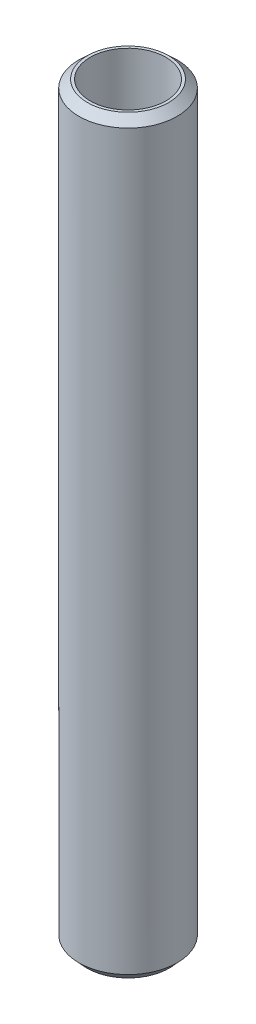
from build123d import *
from OCP.BRepFilletAPI import BRepFilletAPI_MakeChamfer

# Parameters (mm, degrees)
SKETCH1_R           = 22.5
BOSS_EXTRUDE1_DEPTH = 343.666464801
SKETCH2_R           = 17.361282438
CUT_EXTRUDE1_DEPTH  = 346.136406409
CHAMFER1_SIZE       = 3.567688405
CHAMFER1_SIZE2      = 3.870433617


with BuildPart() as part:
    # Sketch1 → Boss-Extrude1 (new body)
    with BuildSketch(Plane(origin=(0, 0, 0), x_dir=(1, 0, 0), z_dir=(0, 1, 0))):
        Circle(SKETCH1_R)
    extrude(amount=BOSS_EXTRUDE1_DEPTH)

    # Sketch2 → Cut-Extrude1 (cut, through all)
    with BuildSketch(Plane(origin=(0, 0, 0), x_dir=(1, 0, 0), z_dir=(0, 1, 0))):
        Circle(SKETCH2_R)
    extrude(amount=CUT_EXTRUDE1_DEPTH, mode=Mode.SUBTRACT)

    # Chamfer1: one chamfer whose edges measure the first distance from different faces: ONE call of the kernel's chamfer builder (chamfer() names one face for all edges)
    chamfer1_edges_1 = [part.edges().sort_by_distance(p)[0] for p in [
        (-22.5, 343.666464801, 0),
    ]]
    chamfer1_side_1 = [part.faces().sort_by_distance(p)[0] for p in [
        (-22.5, 171.833232401, 0),
    ]]
    chamfer1_edges_2 = [part.edges().sort_by_distance(p)[0] for p in [
        (-22.5, 0, 0),
    ]]
    chamfer1_side_2 = [part.faces().sort_by_distance(p)[0] for p in [
        (-21.863603897, 0, 0),
    ]]
    chamfer1 = BRepFilletAPI_MakeChamfer(part.part.solid().wrapped)
    for e in chamfer1_edges_1:
        chamfer1.Add(CHAMFER1_SIZE, CHAMFER1_SIZE2, e.wrapped, chamfer1_side_1[0].wrapped)  # the first distance lies on this face
    for e in chamfer1_edges_2:
        chamfer1.Add(CHAMFER1_SIZE, CHAMFER1_SIZE2, e.wrapped, chamfer1_side_2[0].wrapped)  # the first distance lies on this face
    add(Compound.cast(chamfer1.Shape()), mode=Mode.REPLACE)


solid = part.part
